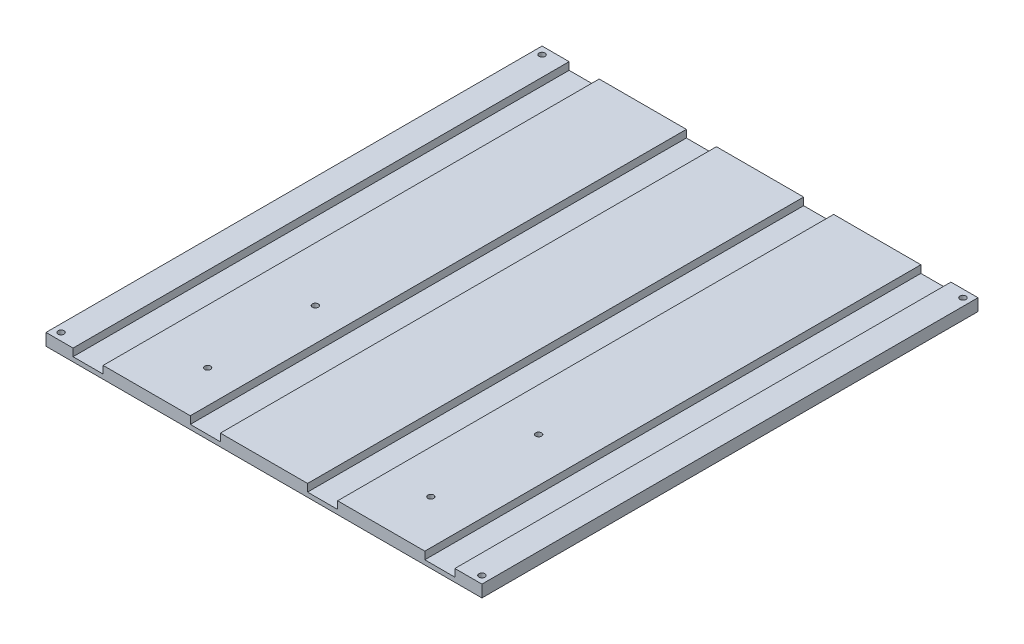
from build123d import *

# Parameters (mm, degrees)
SKETCH2_W           = 145
SKETCH2_H           = 165
BOSS_EXTRUDE1_DEPTH = 4
SKETCH2_3_W         = 10
SKETCH2_3_H         = 165
CUT_EXTRUDE1_DEPTH  = 2.5
SKETCH3_R           = 1
CUT_EXTRUDE3_DEPTH  = 5
SKETCH5_R           = 0.98
CUT_EXTRUDE4_DEPTH  = 4


with BuildPart() as part:
    # Sketch2 → Boss-Extrude1 (new body)
    with BuildSketch(Plane(origin=(0, 0, 0), x_dir=(1, 0, 0), z_dir=(0, 1, 0))):
        Rectangle(SKETCH2_W, SKETCH2_H)
    extrude(amount=-BOSS_EXTRUDE1_DEPTH)

    # Sketch2<3> → Cut-Extrude1 (cut)
    with BuildSketch(Plane(origin=(0, 0, 0), x_dir=(1, 0, 0), z_dir=(0, 1, 0))):
        with Locations((-19.5, 0)):
            Rectangle(SKETCH2_3_W, SKETCH2_3_H)
        with Locations((-58.5, 0)):
            Rectangle(SKETCH2_3_W, SKETCH2_3_H)
        with Locations((19.5, 0)):
            Rectangle(SKETCH2_3_W, SKETCH2_3_H)
        with Locations((58.5, 0)):
            Rectangle(SKETCH2_3_W, SKETCH2_3_H)
    extrude(amount=-CUT_EXTRUDE1_DEPTH, mode=Mode.SUBTRACT)

    # Sketch3 → Cut-Extrude3 (cut)
    with BuildSketch(Plane.XZ.offset(4)):
        with Locations((-70, 80)):
            Circle(SKETCH3_R)
        with Locations((70, 80)):
            Circle(SKETCH3_R)
        with Locations((70, -80)):
            Circle(SKETCH3_R)
        with Locations((-70, -80)):
            Circle(SKETCH3_R)
    extrude(amount=-CUT_EXTRUDE3_DEPTH, mode=Mode.SUBTRACT)

    # Sketch5 → Cut-Extrude4 (cut)
    with BuildSketch(Plane(origin=(0, -4, 0), x_dir=(1, 0, 0), z_dir=(0, 1, 0))):
        with Locations((-35.438735521, -29.971809351)):
            Circle(SKETCH5_R)
        with Locations((38.831264479, -29.971809351)):
            Circle(SKETCH5_R)
        with Locations((38.831264479, -65.811809351)):
            Circle(SKETCH5_R)
        with Locations((-35.438735521, -65.811809351)):
            Circle(SKETCH5_R)
    extrude(amount=CUT_EXTRUDE4_DEPTH, mode=Mode.SUBTRACT)


solid = part.part
